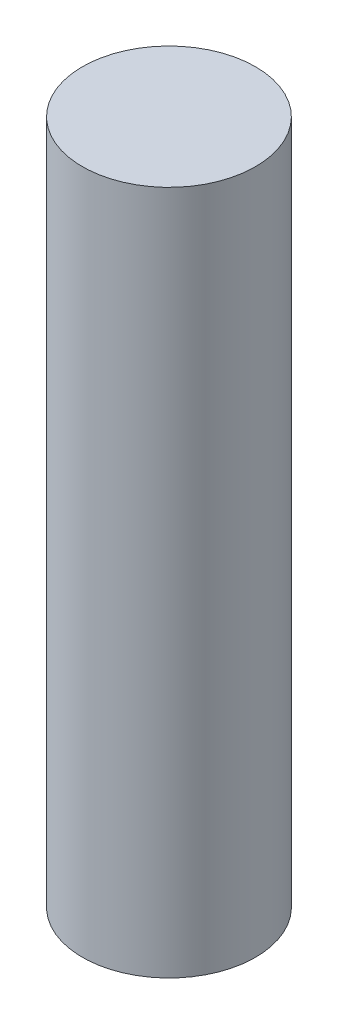
from build123d import *

# Parameters (mm, degrees)
SKETCH1_W = 11
SKETCH1_H = 87


with BuildPart() as part:
    # Sketch1 → Revolve4 (revolve)
    with BuildSketch(Plane.XY):
        with Locations((5.5, 43.5)):
            Rectangle(SKETCH1_W, SKETCH1_H)
    revolve(axis=Axis((11, 0, 0), (0, 1, 0)))


solid = part.part
